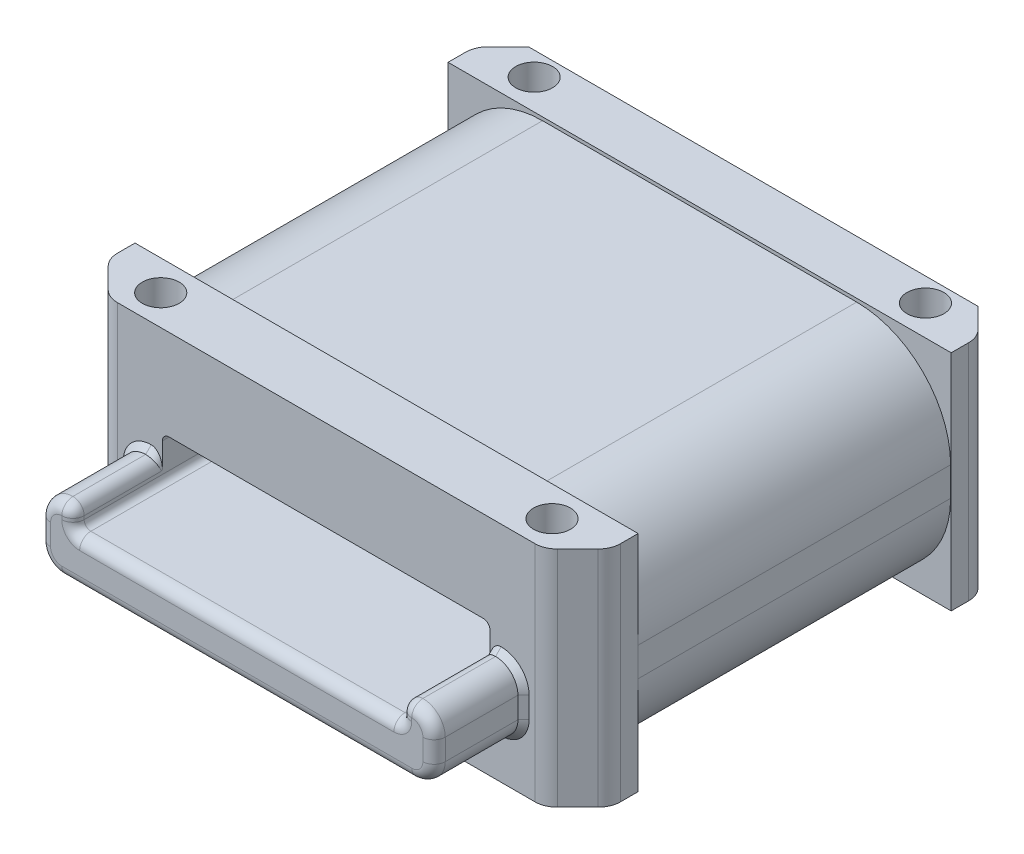
from build123d import *

# Parameters (mm, degrees)
SKETCH1_W             = 34.1
SKETCH1_H             = 6.8
SKETCH1_W_2           = 29.3
SKETCH1_H_2           = 3.8
CENTER_TUBE_DEPTH     = 14
CURVATURE_DEPTH       = 28
SKETCH2_W             = 45
SKETCH2_H             = 20
SKETCH2_W_2           = 29.3
SKETCH2_H_2           = 3.8
FLANGE_DEPTH          = 5.4
M3_CLEARANCE_HOLE1_D  = 3.3
BOSS_EXTRUDE3_DEPTH   = 8
FILLET_CENTER_EDGES_R = 2.5
CHAMFER1_SIZE         = 3
FILLET4_R             = 2
FILLET6_R             = 0.6
CHAMFER2_SIZE         = 0.5
FILLET7_R             = 2
BOSS_EXTRUDE4_DEPTH   = 28
CHAMFER3_SIZE         = 0.6
FILLET8_R             = 1


with BuildPart() as part:
    # Sketch1 → Center Tube (new, symmetric)
    with BuildSketch(Plane.XY):
        Rectangle(SKETCH1_W, SKETCH1_H)
        Rectangle(SKETCH1_W_2, SKETCH1_H_2, mode=Mode.SUBTRACT)
    extrude(amount=CENTER_TUBE_DEPTH, both=True)

    # Sketch55 → Curvature (add)
    with BuildSketch(Plane.XY.offset(14)):
        with BuildLine():
            Line((-17.05, 3.4), (17.05, 3.4))
            ThreePointArc((17.05, 3.4), (0, 5.192160608), (-17.05, 3.4))
        make_face()
        with BuildLine():
            Line((-17.05, -3.4), (17.05, -3.4))
            ThreePointArc((17.05, -3.4), (0, -5.192160608), (-17.05, -3.4))
        make_face()
    extrude(amount=-CURVATURE_DEPTH)

    # Sketch2 → Flange (add)
    with BuildSketch(Plane.XY.offset(14)):
        Rectangle(SKETCH2_W, SKETCH2_H)
        Rectangle(SKETCH2_W_2, SKETCH2_H_2, mode=Mode.SUBTRACT)
    flange = extrude(amount=FLANGE_DEPTH)

    # Mirror1: Flange across plane
    add(flange.mirror(Plane.XY))

    # M3 Clearance Hole1 (through all)
    with Locations(Plane(origin=(0, 10, 0), x_dir=(1, 0, 0), z_dir=(0, 1, 0))):
        with Locations((-17.5, -16.7), (-17.5, 16.7), (17.5, 16.7), (17.5, -16.7)):
            Hole(M3_CLEARANCE_HOLE1_D / 2)

    # Sketch14 → Boss-Extrude3 (add)
    with BuildSketch(Plane.XY.offset(19.4)):
        Polygon((-14.65, 0), (-17.65, 0), (-17.65, -5.9), (17.65, -5.9), (17.65, 0), (14.65, 0), (14.65, -1.9), (-14.65, -1.9), align=None)
    extrude(amount=BOSS_EXTRUDE3_DEPTH)

    # Fillet Center Edges
    fillet_center_edges_edges = [part.edges().sort_by_distance(p)[0] for p in [
        (17.05, -3.4, 0),
        (-17.05, -3.4, 0),
        (-17.05, 3.4, 0),
        (17.05, 3.4, 0),
    ]]
    fillet(fillet_center_edges_edges, radius=FILLET_CENTER_EDGES_R)

    # Chamfer1
    chamfer1_edges = [part.edges().sort_by_distance(p)[0] for p in [
        (-22.5, 0, 19.4),
        (22.5, 0, 19.4),
        (-22.5, 0, -19.4),
        (22.5, 0, -19.4),
    ]]
    chamfer(chamfer1_edges, length=CHAMFER1_SIZE)

    # Fillet4
    fillet4_edges = [part.edges().sort_by_distance(p)[0] for p in [
        (-17.65, 0, 23.4),
        (-17.65, -5.9, 23.4),
        (17.65, -5.9, 23.4),
        (17.65, 0, 23.4),
    ]]
    fillet(fillet4_edges, radius=FILLET4_R)

    # Fillet6
    fillet6_edges = [part.edges().sort_by_distance(p)[0] for p in [
        (14.65, -1.9, 4),
        (14.65, 1.9, 0),
        (-14.65, 1.9, 0),
        (-14.65, -1.9, 4),
    ]]
    fillet(fillet6_edges, radius=FILLET6_R)

    # Chamfer2
    chamfer2_edges = [part.edges().sort_by_distance(p)[0] for p in [
        (-15.15, 0, 19.4),
        (0, -5.192160608, -14),
        (0, -5.192160608, 14),
        (-17.05, 0, -14),
        (-17.05, 0, 14),
        (0, 5.192160608, -14),
        (0, 5.192160608, 14),
        (17.05, 0, -14),
        (17.05, 0, 14),
        (-16.472741262, -2.94718964, -14),
        (-16.472741262, -2.94718964, 14),
        (16.472741262, 2.94718964, -14),
        (16.472741262, 2.94718964, 14),
        (16.472741262, -2.94718964, -14),
        (16.472741262, -2.94718964, 14),
        (-16.472741262, 2.94718964, -14),
        (-16.472741262, 2.94718964, 14),
        (17.65, -2.95, 19.4),
        (0, -5.9, 19.4),
        (-17.65, -2.95, 19.4),
        (15.15, 0, 19.4),
        (17.064213562, -5.314213562, 19.4),
        (-17.064213562, -5.314213562, 19.4),
        (17.064213562, -0.585786438, 19.4),
        (-17.064213562, -0.585786438, 19.4),
    ]]
    chamfer(chamfer2_edges, length=CHAMFER2_SIZE)

    # Fillet7
    fillet7_edges = [part.edges().sort_by_distance(p)[0] for p in [
        (-22.5, 0, -16.4),
        (22.5, 0, -16.4),
        (-19.5, 0, 19.4),
        (19.5, 0, 19.4),
        (22.5, 0, 16.4),
        (-22.5, 0, 16.4),
    ]]
    fillet(fillet7_edges, radius=FILLET7_R)

    # Chamfer3
    chamfer3_edges = [part.edges().sort_by_distance(p)[0] for p in [
        (0, -10, -19.4),
        (0, 10, -19.4),
        (0, 1.9, -19.4),
        (-14.65, 0, -19.4),
        (14.65, 0, -19.4),
        (0, -1.9, -19.4),
        (-14.474264069, 1.724264069, -19.4),
        (14.474264069, 1.724264069, -19.4),
        (14.474264069, -1.724264069, -19.4),
        (-14.474264069, -1.724264069, -19.4),
    ]]
    chamfer(chamfer3_edges, length=CHAMFER3_SIZE)

    # Fillet8
    fillet8_edges = [part.edges().sort_by_distance(p)[0] for p in [
        (-19.5, 0, -19.4),
        (19.5, 0, -19.4),
        (-17.064213562, -5.314213562, 27.4),
        (-17.65, -2.95, 27.4),
        (-17.064213562, -0.585786438, 27.4),
        (-14.65, -0.65, 27.4),
        (-14.474264069, -1.724264069, 27.4),
        (0, -1.9, 27.4),
        (14.474264069, -1.724264069, 27.4),
        (14.65, -0.65, 27.4),
        (17.064213562, -0.585786438, 27.4),
        (17.65, -2.95, 27.4),
        (17.064213562, -5.314213562, 27.4),
        (0, -5.9, 27.4),
        (14.65, 0, 23.65),
        (-14.65, 0, 23.65),
        (14.65, 0.25, 19.65),
        (-14.65, 0.25, 19.65),
    ]]
    fillet(fillet8_edges, radius=FILLET8_R - 0.0001)  # a hair under: the kernel refuses the full size


with BuildPart() as body_2:
    # Sketch54 → Boss-Extrude4 (new body)
    with BuildSketch(Plane(origin=(0, 0, 14), x_dir=(-1, 0, 0), z_dir=(0, 0, -1))):
        with BuildLine():
            Line((22.45, 1.3), (22.45, -1.3))
            ThreePointArc((22.45, -1.3), (19.989696962, -7.239696962), (14.05, -9.7))
            Line((14.05, -9.7), (-14.05, -9.7))
            ThreePointArc((-14.05, -9.7), (-19.989696962, -7.239696962), (-22.45, -1.3))
            Line((-22.45, -1.3), (-22.45, 1.3))
            ThreePointArc((-22.45, 1.3), (-19.989696962, 7.239696962), (-14.05, 9.7))
            Line((-14.05, 9.7), (14.05, 9.7))
            ThreePointArc((14.05, 9.7), (19.989696962, 7.239696962), (22.45, 1.3))
        make_face()
        with BuildLine():
            Line((15.15, 1.3), (15.15, -1.3))
            ThreePointArc((15.15, -1.3), (14.827817459, -2.077817459), (14.05, -2.4))
            Line((14.05, -2.4), (-14.05, -2.4))
            ThreePointArc((-14.05, -2.4), (-14.827817459, -2.077817459), (-15.15, -1.3))
            Line((-15.15, -1.3), (-15.15, 1.3))
            ThreePointArc((-15.15, 1.3), (-14.827817459, 2.077817459), (-14.05, 2.4))
            Line((-14.05, 2.4), (14.05, 2.4))
            ThreePointArc((14.05, 2.4), (14.827817459, 2.077817459), (15.15, 1.3))
        make_face(mode=Mode.SUBTRACT)
    extrude(amount=BOSS_EXTRUDE4_DEPTH)


solid = Compound([part.part, body_2.part])
